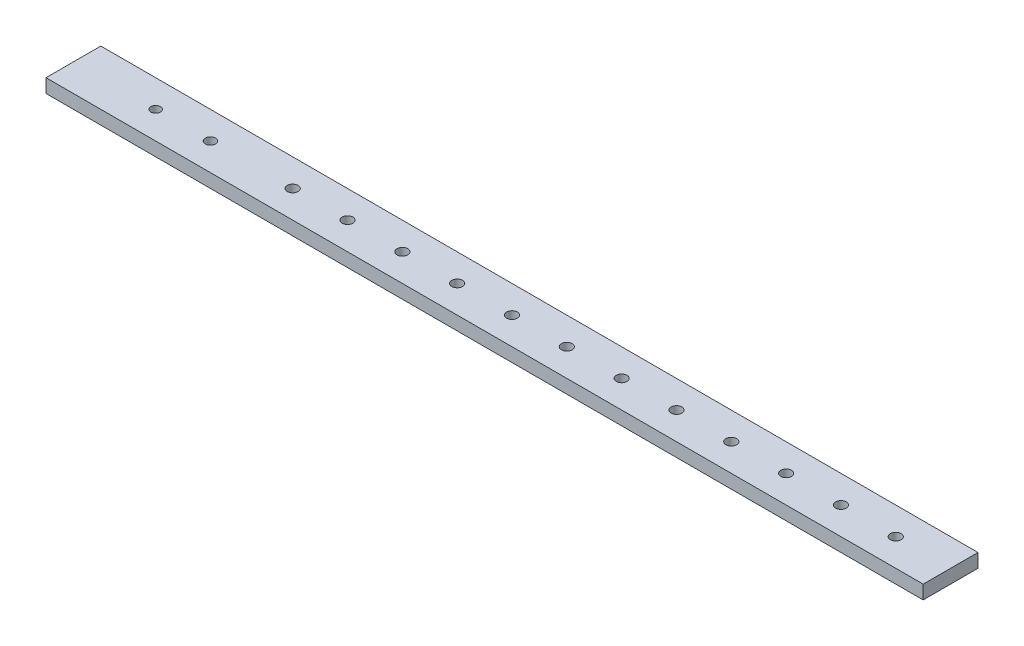
from build123d import *

# Parameters (mm, degrees)
SKETCH1_W               = 406.4
SKETCH1_H               = 25.4
BOSS_EXTRUDE1_DEPTH     = 6.35
CUT_EXTRUDE1_DEPTH      = 408.242486119
CUT_EXTRUDE1_DEPTH_BACK = 408.242486119
SKETCH2_R               = 2.4892
SKETCH3_R               = 2.378070279
SKETCH3_R_2             = 2.20737703
CUT_EXTRUDE2_DEPTH      = 408.242486119


with BuildPart() as part:
    # Sketch1 → Boss-Extrude1 (new body)
    with BuildSketch(Plane(origin=(0, 0, 0), x_dir=(1, 0, 0), z_dir=(0, 1, 0))):
        with Locations((203.2, 12.7)):
            Rectangle(SKETCH1_W, SKETCH1_H)
    extrude(amount=BOSS_EXTRUDE1_DEPTH)

    # Sketch2 → Cut-Extrude1 (cut, two sides: drawn at the far end of the back side and taken through both)
    with BuildSketch(Plane(origin=(0, 6.35, 0), x_dir=(1, 0, 0), z_dir=(0, 1, 0)).offset(-CUT_EXTRUDE1_DEPTH_BACK)):
        with Locations((381, 12.7)):
            Circle(SKETCH2_R)
        with Locations((355.6, 12.7)):
            Circle(SKETCH2_R)
        with Locations((330.2, 12.7)):
            Circle(SKETCH2_R)
        with Locations((304.8, 12.7)):
            Circle(SKETCH2_R)
        with Locations((279.4, 12.7)):
            Circle(SKETCH2_R)
        with Locations((254, 12.7)):
            Circle(SKETCH2_R)
        with Locations((228.6, 12.7)):
            Circle(SKETCH2_R)
        with Locations((203.2, 12.7)):
            Circle(SKETCH2_R)
        with Locations((177.8, 12.7)):
            Circle(SKETCH2_R)
        with Locations((152.4, 12.7)):
            Circle(SKETCH2_R)
        with Locations((127, 12.7)):
            Circle(SKETCH2_R)
        with Locations((101.6, 12.7)):
            Circle(SKETCH2_R)
    extrude(amount=CUT_EXTRUDE1_DEPTH + CUT_EXTRUDE1_DEPTH_BACK, mode=Mode.SUBTRACT)

    # Sketch3 → Cut-Extrude2 (cut, through all)
    with BuildSketch(Plane.XZ):
        with Locations((63.5, -12.7)):
            Circle(SKETCH3_R)
        with Locations((38.1, -12.7)):
            Circle(SKETCH3_R_2)
    extrude(amount=-CUT_EXTRUDE2_DEPTH, mode=Mode.SUBTRACT)


solid = part.part
